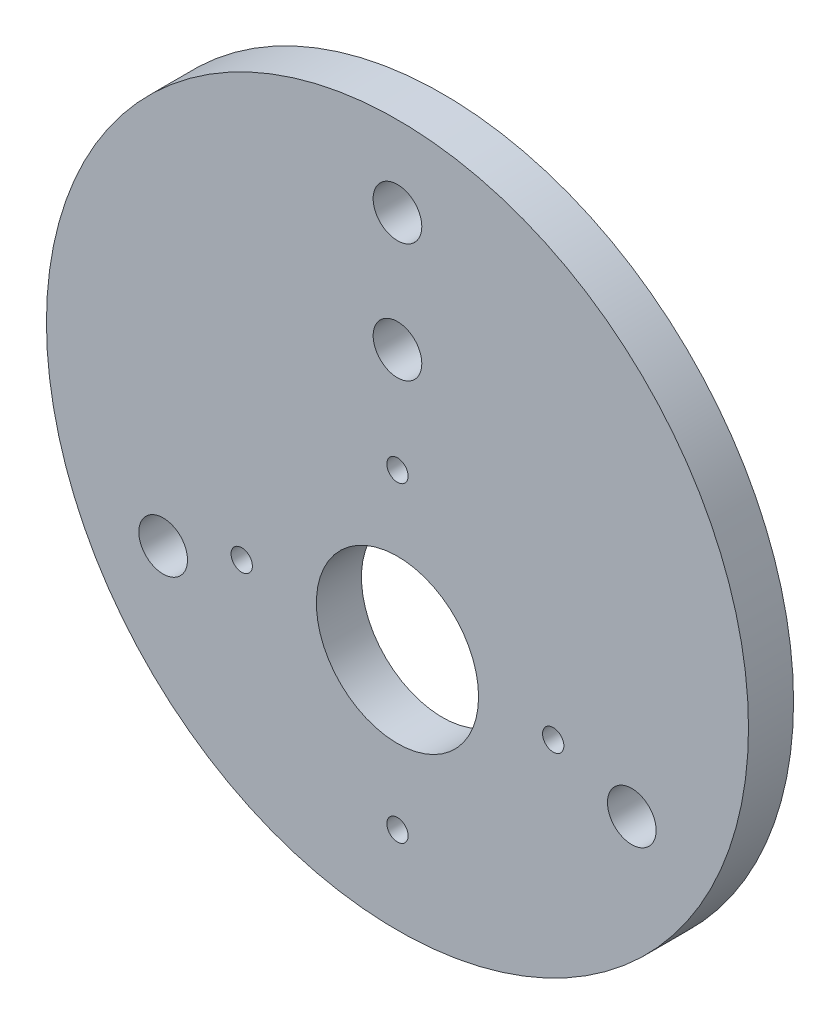
from build123d import *

# Parameters (mm, degrees)
SKETCH1_R                        = 49.4665
BOSS_EXTRUDE1_DEPTH              = 6.35
M3_SCREW_HOLE_3_0MM_DOWEL_HOLE_D = 3
SKETCH6_R                        = 3.429
CUT_EXTRUDE2_DEPTH               = 71.243802179
SKETCH7_R                        = 11.43
CUT_EXTRUDE3_DEPTH               = 71.243802179
SKETCH5_R                        = 3.429
CUT_EXTRUDE4_DEPTH               = 71.243802179


with BuildPart() as part:
    # Sketch1 → Boss-Extrude1 (new body)
    with BuildSketch(Plane.XY):
        Circle(SKETCH1_R)
    extrude(amount=BOSS_EXTRUDE1_DEPTH)

    # M3 Screw Hole - Ø3.0mm Dowel Hole (through all)
    with Locations(Plane.XY.offset(6.35)):
        with Locations((0, 6.70774596), (-21.94774596, -15.24), (0, -37.18774596), (21.94774596, -15.24)):
            Hole(M3_SCREW_HOLE_3_0MM_DOWEL_HOLE_D / 2)

    # Sketch6 → Cut-Extrude2 (cut, through all)
    with BuildSketch(Plane.XY.offset(6.35)):
        with Locations((0, 38.128211777)):
            Circle(SKETCH6_R)
        with Locations((-33.02, -19.064105889)):
            Circle(SKETCH6_R)
        with Locations((33.02, -19.064105889)):
            Circle(SKETCH6_R)
    extrude(amount=-CUT_EXTRUDE2_DEPTH, mode=Mode.SUBTRACT)

    # Sketch7 → Cut-Extrude3 (cut, through all)
    with BuildSketch(Plane.XY.offset(6.35)):
        with Locations((0, -15.24)):
            Circle(SKETCH7_R)
    extrude(amount=-CUT_EXTRUDE3_DEPTH, mode=Mode.SUBTRACT)

    # Sketch5 → Cut-Extrude4 (cut, through all)
    with BuildSketch(Plane.XY.offset(6.35)):
        with Locations((0, 21.399444974)):
            Circle(SKETCH5_R)
    extrude(amount=-CUT_EXTRUDE4_DEPTH, mode=Mode.SUBTRACT)


solid = part.part
